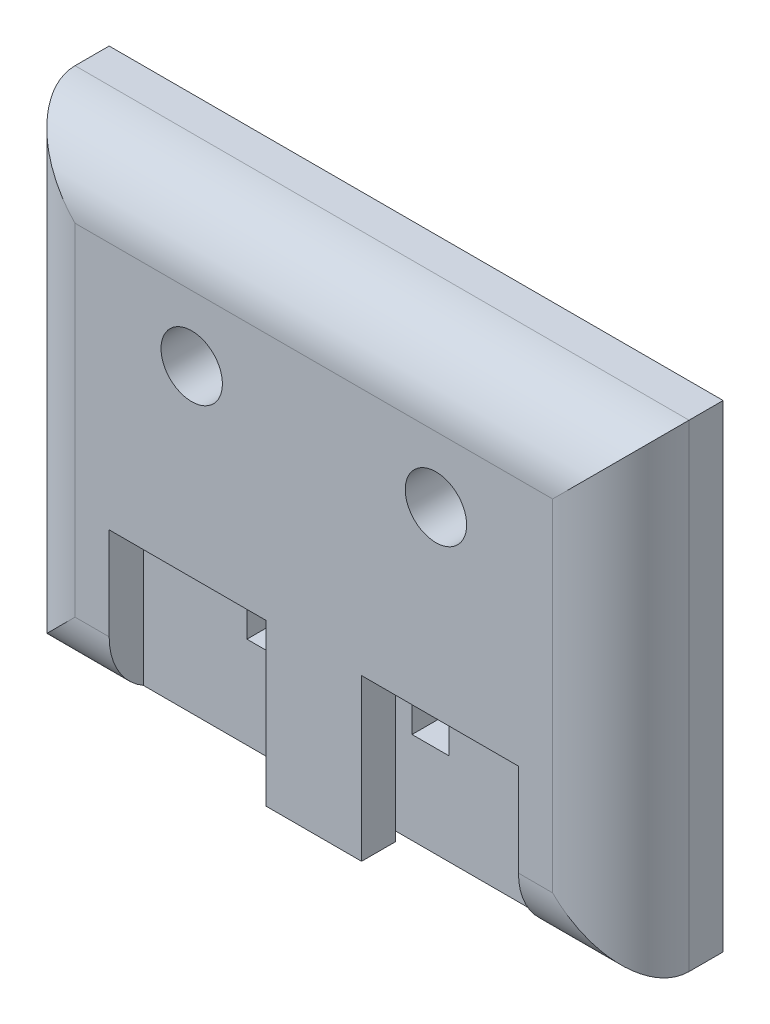
from build123d import *

# Parameters (mm, degrees)
BOSS_EXTRUDE3_DEPTH       = 90
SKETCH3_R                 = 2.1
CUT_EXTRUDE1_DEPTH        = 101.729866263
SKETCH7_W                 = 60
SKETCH7_H                 = 23.583098141
CUT_EXTRUDE3_DEPTH        = 5
SKETCH8_W                 = 5.4
SKETCH8_H                 = 5.4
CUT_EXTRUDE4_DEPTH        = 10.2
FILLET3_R                 = 10
SKETCH9_W                 = 14
SKETCH9_H                 = 23.583098141
BOSS_EXTRUDE4_DEPTH       = 5
ADVANCEDHOLE2_START       = 3.782223439
ADVANCEDHOLE2_OUTLINE_R   = 4.5
ADVANCEDHOLE2_OUTLINE_R_2 = 2.1
ADVANCEDHOLE2_DEPTH       = 10.5


# Read off the part's stored shape, not the designer's step: AdvancedHole2
with BuildPart() as part:
    # Sketch1 → Boss-Extrude3 (new body)
    with BuildSketch(Plane.YZ):
        Polygon((-42.679104458, 14.282223439), (-12.679104458, 14.282223439), (27.320895542, 14.282223439), (27.320895542, -0.717776561), (-42.679104458, -0.717776561), (-42.679104458, 2.342667118), align=None)
    extrude(amount=BOSS_EXTRUDE3_DEPTH)

    # Sketch3 → Cut-Extrude1 (cut, through all)
    with BuildSketch(Plane(origin=(0, 0, -0.717776561), x_dir=(1, 0, 0), z_dir=(0, 0, -1))):
        with Locations(Location((57.1, 25.179104458, 0), (0, 0, 180))):
            Circle(SKETCH3_R)
        with Locations((32.9, 25.179104458)):
            Circle(SKETCH3_R)
        with Locations(Location((62.9, -7.720895542, 0), (0, 0, 180))):
            Circle(SKETCH3_R)
        with Locations((27.1, -7.720895542)):
            Circle(SKETCH3_R)
    extrude(amount=-CUT_EXTRUDE1_DEPTH, mode=Mode.SUBTRACT)

    # Sketch7 → Cut-Extrude3 (cut)
    with BuildSketch(Plane.XY.offset(14.282223439)):
        with Locations((45, -30.887555388)):
            Rectangle(SKETCH7_W, SKETCH7_H)
    extrude(amount=-CUT_EXTRUDE3_DEPTH, mode=Mode.SUBTRACT)

    # Sketch8 → Cut-Extrude4 (cut)
    with BuildSketch(Plane.XY.offset(9.282223439)):
        with Locations((32.9, -25.179104458)):
            Rectangle(SKETCH8_W, SKETCH8_H)
        with Locations((57.1, -25.179104458)):
            Rectangle(SKETCH8_W, SKETCH8_H)
    extrude(amount=-CUT_EXTRUDE4_DEPTH, mode=Mode.SUBTRACT)

    # Fillet3
    # the kernel refuses this fillet: 10 mm, written as the material it takes off along each edge
    with BuildSketch(Plane(origin=(-60, 27.320895542, 14.282223439), x_dir=(0, -1, 0), z_dir=(1, 0, 0))) as fillet3_piece_1:
        with BuildLine():
            CenterArc((FILLET3_R, FILLET3_R), FILLET3_R, 180, 90)
            Line((0, FILLET3_R), (-FILLET3_R * 0.02, FILLET3_R))
            Line((-FILLET3_R * 0.02, FILLET3_R), (-FILLET3_R * 0.02, -FILLET3_R * 0.02))
            Line((-FILLET3_R * 0.02, -FILLET3_R * 0.02), (FILLET3_R, -FILLET3_R * 0.02))
            Line((FILLET3_R, -FILLET3_R * 0.02), (FILLET3_R, 0))
        make_face()
    extrude(amount=210, mode=Mode.SUBTRACT)
    with BuildSketch(Plane(origin=(15, -42.679104458, 14.282223439), x_dir=(0, 1, 0), z_dir=(1, 0, 0)), Plane(origin=(-60, -42.679104458, 14.282223439), x_dir=(0, 1, 0), z_dir=(1, 0, 0))) as fillet3_piece_2:
        with BuildLine():
            CenterArc((FILLET3_R, -FILLET3_R), FILLET3_R, 90, 90)
            Line((0, -FILLET3_R), (-FILLET3_R * 0.0200000000001, -FILLET3_R))
            Line((-FILLET3_R * 0.0200000000001, -FILLET3_R), (-FILLET3_R * 0.02, FILLET3_R * 0.02))
            Line((-FILLET3_R * 0.02, FILLET3_R * 0.02), (FILLET3_R, FILLET3_R * 0.02))
            Line((FILLET3_R, FILLET3_R * 0.02), (FILLET3_R, 0))
        make_face()
    extrude(amount=135, mode=Mode.SUBTRACT)
    with BuildSketch(Plane(origin=(90, -102.679104458, 14.282223439), x_dir=(-1, 0, 0), z_dir=(0, 1, 0)), Plane(origin=(0, 87.320895542, 14.282223439), x_dir=(1, 0, 0), z_dir=(0, -1, 0))) as fillet3_piece_3:
        with BuildLine():
            CenterArc((FILLET3_R, -FILLET3_R), FILLET3_R, 90, 90)
            Line((0, -FILLET3_R), (-FILLET3_R * 0.02, -FILLET3_R))
            Line((-FILLET3_R * 0.02, -FILLET3_R), (-FILLET3_R * 0.02, FILLET3_R * 0.02))
            Line((-FILLET3_R * 0.02, FILLET3_R * 0.02), (FILLET3_R, FILLET3_R * 0.02))
            Line((FILLET3_R, FILLET3_R * 0.02), (FILLET3_R, 0))
        make_face()
    extrude(amount=190, mode=Mode.SUBTRACT)

    # Sketch9 → Boss-Extrude4 (add)
    with BuildSketch(Plane.XY.offset(9.282223439)):
        with Locations((45, -30.887555388)):
            Rectangle(SKETCH9_W, SKETCH9_H)
    extrude(amount=BOSS_EXTRUDE4_DEPTH)

    # AdvancedHole2 outline → AdvancedHole2 (cut)
    # profile 1 of 2: a face of its own
    with BuildSketch(Plane.XY.offset(ADVANCEDHOLE2_START)):
        with Locations((62.9, 7.720895542)):
            Circle(ADVANCEDHOLE2_OUTLINE_R)
        with Locations((62.9, 7.720895542)):
            Circle(ADVANCEDHOLE2_OUTLINE_R_2, mode=Mode.SUBTRACT)
    # profile 2 of 2: a face of its own
    with BuildSketch(Plane.XY.offset(ADVANCEDHOLE2_START)):
        with Locations((27.1, 7.720895542)):
            Circle(ADVANCEDHOLE2_OUTLINE_R)
        with Locations((27.1, 7.720895542)):
            Circle(ADVANCEDHOLE2_OUTLINE_R_2, mode=Mode.SUBTRACT)
    extrude(amount=ADVANCEDHOLE2_DEPTH, mode=Mode.SUBTRACT)


solid = part.part
